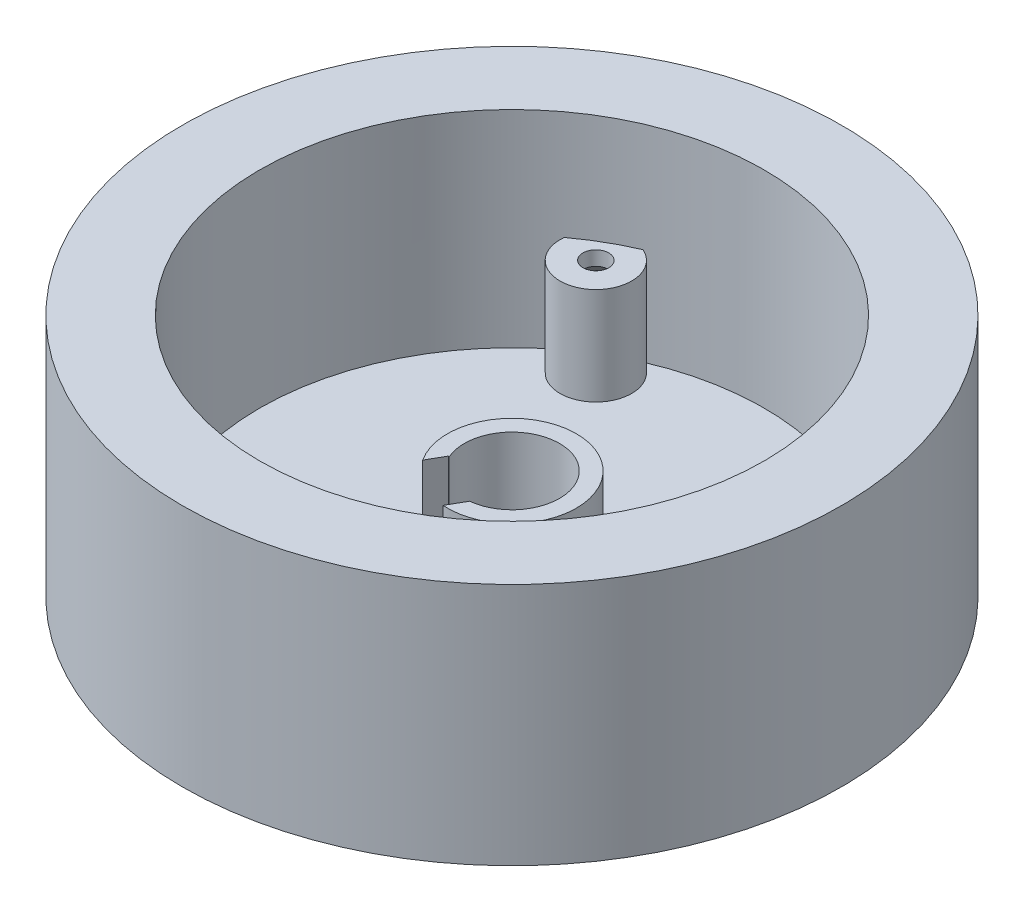
from build123d import *

# Parameters (mm, degrees)
SKETCH1_R                                    = 23
BOSS_EXTRUDE1_DEPTH                          = 17
SHELL1_T                                     = -2.6
SKETCH4_R                                    = 4.5
BOSS_EXTRUDE3_DEPTH                          = 5
SKETCH5_R                                    = 3.325
CUT_EXTRUDE2_DEPTH                           = 34.857938508
SKETCH22_R                                   = 20.4
SKETCH22_R_2                                 = 17.6
BOSS_EXTRUDE10_DEPTH                         = 14.4
SKETCH24_R                                   = 2.5
BOSS_EXTRUDE11_DEPTH                         = 6.8
CSK_SLOT_FOR_M1_6_COUNTERSUNK_FLAT_H_2_COUNT = 2
CSK_SLOT_FOR_M1_6_COUNTERSUNK_FLAT_H_2_PITCH = 27.712812921
CSK_SLOT_FOR_M1_6_COUNTERSUNK_FLAT_H_3_COUNT = 2
CSK_SLOT_FOR_M1_6_COUNTERSUNK_FLAT_H_3_PITCH = 27.712812921
BOSS_EXTRUDE12_DEPTH                         = 6
SKETCH29_W                                   = 2
SKETCH29_H                                   = 3
CUT_EXTRUDE5_DEPTH                           = 47.005728796
FILLET2_R                                    = 2
SKETCH30_W                                   = 8
SKETCH30_H                                   = 3.3
CUT_EXTRUDE6_DEPTH                           = 4.5
BOSS_EXTRUDE13_DEPTH                         = 0.6
BOSS_EXTRUDE14_DEPTH                         = 0.6
CUT_EXTRUDE7_START                           = -13.6
CUT_EXTRUDE7_DEPTH                           = 13.6


# Read off the part's stored shape, not the designer's step: Cut-Extrude7
with BuildPart() as part:
    # Sketch1 → Boss-Extrude1 (new body)
    with BuildSketch(Plane(origin=(0, 0, 0), x_dir=(1, 0, 0), z_dir=(0, 1, 0))):
        with Locations(Location((0, 0, 0), (0, 0, 270))):
            Circle(SKETCH1_R)
    extrude(amount=BOSS_EXTRUDE1_DEPTH)

    # Shell1
    shell1_openings = [part.faces().sort_by_distance(p)[0] for p in [
        (0, 17, 0),
    ]]
    offset(amount=SHELL1_T, openings=shell1_openings, kind=Kind.INTERSECTION)

    # Sketch4 → Boss-Extrude3 (add)
    with BuildSketch(Plane(origin=(0, 2.6, 0), x_dir=(1, 0, 0), z_dir=(0, 1, 0))):
        with Locations(Location((0, 0, 0), (0, 0, 270))):
            Circle(SKETCH4_R)
    extrude(amount=BOSS_EXTRUDE3_DEPTH)

    # Sketch5 → Cut-Extrude2 (cut, through all)
    with BuildSketch(Plane(origin=(0, 7.6, 0), x_dir=(1, 0, 0), z_dir=(0, 1, 0))):
        with Locations(Location((0, 0, 0), (0, 0, 270))):
            Circle(SKETCH5_R)
    extrude(amount=-CUT_EXTRUDE2_DEPTH, mode=Mode.SUBTRACT)

    # Sketch22 → Boss-Extrude10 (add)
    with BuildSketch(Plane(origin=(0, 2.6, 0), x_dir=(1, 0, 0), z_dir=(0, 1, 0))):
        Circle(SKETCH22_R)
        with Locations(Location((0, 0, 0), (0, 0, 270))):
            Circle(SKETCH22_R_2, mode=Mode.SUBTRACT)
    extrude(amount=BOSS_EXTRUDE10_DEPTH)

    # Sketch24 → Boss-Extrude11 (add)
    with BuildSketch(Plane(origin=(0, 2.6, 0), x_dir=(1, 0, 0), z_dir=(0, 1, 0))):
        with Locations((-8, 13.856406461)):
            Circle(SKETCH24_R)
        with Locations((16, 0)):
            Circle(SKETCH24_R)
        with Locations((-8, -13.856406461)):
            Circle(SKETCH24_R)
    extrude(amount=BOSS_EXTRUDE11_DEPTH)

    # Sketch26 → CSK SLOT for M1.6 Countersunk Flat Head (revolve, cut)
    with BuildSketch(Plane(origin=(-8, 0, 13.856406461), x_dir=(0, 0, -1), z_dir=(1, 0, 0))):
        Polygon((0, 0), (0, 17), (0.9, 17), (0.9, 8.4), (1.8, 7.5), (1.8, 0), align=None)
    csk_slot_for_m1_6_countersunk_flat_head = revolve(axis=Axis((-8, -6.35, 13.856406461), (0, 1, 0)), mode=Mode.SUBTRACT)

    # CSK SLOT for M1.6 Countersunk Flat H 2: CSK SLOT for M1.6 Countersunk Flat Head ×2
    with Locations(*[(0, 0, -i * CSK_SLOT_FOR_M1_6_COUNTERSUNK_FLAT_H_2_PITCH) for i in range(1, CSK_SLOT_FOR_M1_6_COUNTERSUNK_FLAT_H_2_COUNT)]):
        add(csk_slot_for_m1_6_countersunk_flat_head, mode=Mode.SUBTRACT)

    # CSK SLOT for M1.6 Countersunk Flat H 3: CSK SLOT for M1.6 Countersunk Flat Head ×2
    with Locations(*[Vector(0.8660254037844364, 0, -0.5000000000000041) * (i * CSK_SLOT_FOR_M1_6_COUNTERSUNK_FLAT_H_3_PITCH) for i in range(1, CSK_SLOT_FOR_M1_6_COUNTERSUNK_FLAT_H_3_COUNT)]):
        add(csk_slot_for_m1_6_countersunk_flat_head, mode=Mode.SUBTRACT)

    # Sketch28 → Boss-Extrude12 (add)
    with BuildSketch(Plane.XZ):
        with BuildLine():
            Line((-1.694333823, 2.860919065), (-5.263926338, 9.085385824))
            Line((-5.263926338, 9.085385824), (-10.902522986, 5.851776718))
            Line((-10.902522986, 5.851776718), (2.031913438, -16.702609871))
            Line((2.031913438, -16.702609871), (7.670510085, -13.469000765))
            Line((7.670510085, -13.469000765), (1.613572817, -2.907233696))
            ThreePointArc((1.613572817, -2.907233696), (-2.884359054, -1.654115427), (-1.694333823, 2.860919065))
        make_face()
        with BuildLine():
            Line((0.374670309, 12.31899493), (-5.263926338, 9.085385824))
            Line((-5.263926338, 9.085385824), (-1.694333823, 2.860919065))
            ThreePointArc((-1.694333823, 2.860919065), (1.646506155, 2.888709484), (3.325, 0))
            ThreePointArc((3.325, 0), (2.865375597, -1.686786202), (1.613572817, -2.907233696))
            Line((1.613572817, -2.907233696), (7.670510085, -13.469000765))
            Line((7.670510085, -13.469000765), (13.309106732, -10.23539166))
            Line((13.309106732, -10.23539166), (0.374670309, 12.31899493))
        make_face()
    extrude(amount=BOSS_EXTRUDE12_DEPTH)

    # Sketch29 → Cut-Extrude5 (cut, through all)
    with BuildSketch(Plane(origin=(-5.223545836, 0, 9.108543139), x_dir=(0.8674764072728275, 0, 0.4974783239750529), z_dir=(-0.4974783239750529, 0, 0.8674764072728275))):
        with Locations((-5.546549396, -1.5)):
            Rectangle(SKETCH29_W, SKETCH29_H)
        with Locations((5.453450604, -1.5)):
            Rectangle(SKETCH29_W, SKETCH29_H)
    extrude(amount=-CUT_EXTRUDE5_DEPTH, mode=Mode.SUBTRACT)

    # Fillet2
    fillet2_edges = [part.edges().sort_by_distance(p)[0] for p in [
        (-10.902522986, -4.5, 5.851776718),
        (0.374670309, -4.5, 12.31899493),
        (-5.263926338, -6, 9.085385824),
    ]]
    fillet(fillet2_edges, radius=FILLET2_R)

    # Sketch30 → Cut-Extrude6 (cut)
    with BuildSketch(Plane(origin=(-5.223545836, 0, 9.108543139), x_dir=(0.8674764072728275, 0, 0.4974783239750529), z_dir=(-0.4974783239750529, 0, 0.8674764072728275))):
        with Locations((-0.046549396, -4.35)):
            Rectangle(SKETCH30_W, SKETCH30_H)
    extrude(amount=-CUT_EXTRUDE6_DEPTH, mode=Mode.SUBTRACT)

    # Sketch31 → Boss-Extrude13 (add)
    with BuildSketch(Plane.XZ.offset(6)):
        Polygon((-6.49517951, 3.191828695), (0.444631749, 7.171655287), (-1.147298888, 9.94757979), (-8.087110146, 5.967753198), align=None)
    extrude(amount=-BOSS_EXTRUDE13_DEPTH)

    # Sketch33 → Boss-Extrude14 (add)
    with BuildSketch(Plane(origin=(0, -5.4, 0), x_dir=(1, 0, 0), z_dir=(0, 1, 0))):
        Polygon((-6.49517951, -3.191828695), (0.444631749, -7.171655287), (-0.550324899, -8.906608101), (-7.490136157, -4.92678151), align=None)
    extrude(amount=BOSS_EXTRUDE14_DEPTH)

    # Cut-Extrude7 outline → Cut-Extrude7 (cut)
    with BuildSketch(Plane.XZ.offset(6).offset(CUT_EXTRUDE7_START)):
        with BuildLine():
            Line((-3.118548226, 1.324113199), (-3.026514963, 1.376892218))
            ThreePointArc((-3.026514963, 1.376892218), (-1.654115427, 2.884359054), (0.340085146, 3.307562107))
            Line((0.340085146, 3.307562107), (0.351357403, 3.314026495))
            Line((0.351357403, 3.314026495), (-2.882251703, 8.952623142))
            Line((-2.882251703, 8.952623142), (-6.352157332, 6.962709846))
            Line((-6.352157332, 6.962709846), (-3.118548226, 1.324113199))
        make_face()
    extrude(amount=CUT_EXTRUDE7_DEPTH, mode=Mode.SUBTRACT)


solid = part.part
